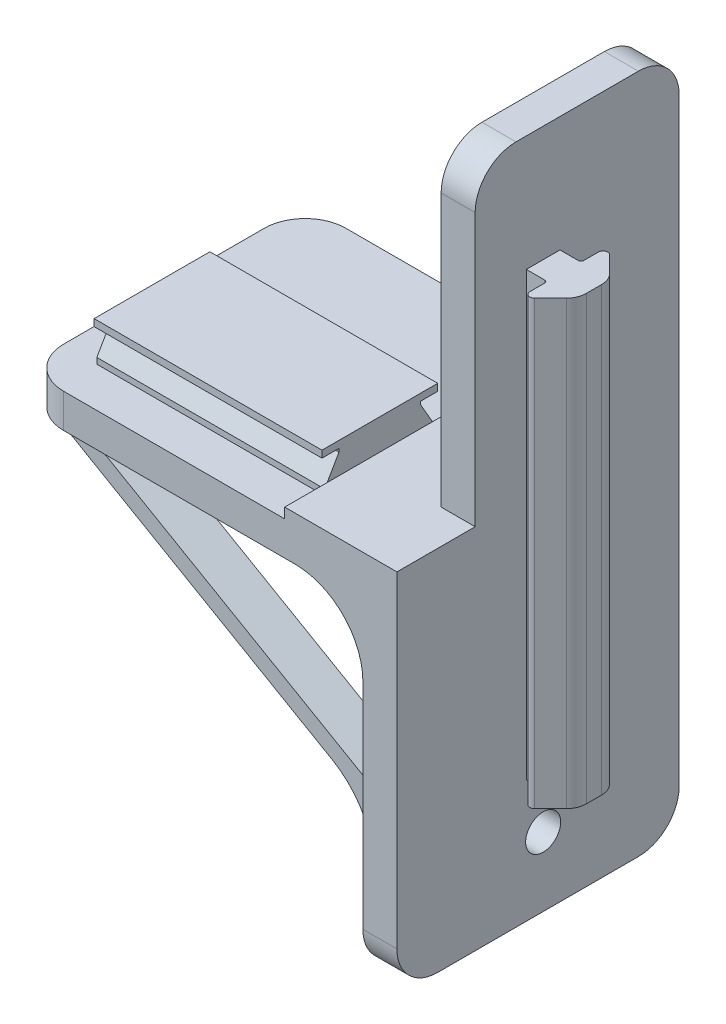
from build123d import *

# Parameters (mm, degrees)
BOSS_EXTRUDE5_DEPTH  = 50
SKETCH11_W           = 41.5
SKETCH11_H           = 100
BOSS_EXTRUDE6_DEPTH  = 5
SKETCH12_W           = 41.5
SKETCH12_H           = 5
BOSS_EXTRUDE8_DEPTH  = 55
SKETCH13_W           = 11.5
SKETCH13_H           = 47.5
CUT_EXTRUDE1_DEPTH   = 55
BOSS_EXTRUDE9_DEPTH  = 6
FILLET7_R            = 12
FILLET7_OF_MIRROR1_R = 12
FILLET8_R            = 6
BOSS_EXTRUDE10_START = 8
BOSS_EXTRUDE10_DEPTH = 8
FILLET12_R           = 10
BOSS_EXTRUDE11_DEPTH = 57
SKETCH16_R           = 2.575
CUT_EXTRUDE2_DEPTH   = 10
SKETCH17_W           = 27.480150942
SKETCH17_H           = 1.5
BOSS_EXTRUDE12_DEPTH = 11.5
SKETCH18_W           = 11.5
SKETCH18_H           = 1.5
BOSS_EXTRUDE13_DEPTH = 5
BOSS_EXTRUDE14_START = -5
BOSS_EXTRUDE14_DEPTH = 33.5


with BuildPart() as part:
    # Sketch9 → Boss-Extrude5 (new body)
    with BuildSketch(Plane(origin=(0, 245, 0), x_dir=(1, 0, 0), z_dir=(0, 1, 0))):
        with BuildLine():
            Line((389.629800237, -111.599739584), (387.629800237, -111.599739584))
            Line((387.629800237, -111.599739584), (387.629800237, -106.649739584))
            Line((387.629800237, -106.649739584), (389.629800237, -106.649739584))
            Line((389.629800237, -106.649739584), (390.329799474, -106.649739584))
            ThreePointArc((390.329799474, -106.649739584), (390.605571069, -106.535511279), (390.719799474, -106.259739725))
            Line((390.719799474, -106.259739725), (390.719800256, -104.090618139))
            ThreePointArc((390.719800256, -104.090618139), (391.145748802, -103.453141463), (391.897703935, -103.602714709))
            Line((391.897703935, -103.602714709), (394.237480965, -105.942491739))
            ThreePointArc((394.237480965, -105.942491739), (394.868289671, -106.886563682), (395.089800232, -108.000172467))
            Line((395.089800232, -108.000172467), (395.089800237, -110.249306685))
            ThreePointArc((395.089800237, -110.249306685), (394.868289678, -111.362915477), (394.23748097, -112.306987424))
            Line((394.23748097, -112.306987424), (391.897703941, -114.646764454))
            ThreePointArc((391.897703941, -114.646764454), (391.145748809, -114.7963377), (390.719800262, -114.158861025))
            Line((390.719800262, -114.158861025), (390.719799474, -111.989739443))
            ThreePointArc((390.719799474, -111.989739443), (390.605571069, -111.71396789), (390.329799474, -111.599739584))
            Line((390.329799474, -111.599739584), (389.629800237, -111.599739584))
        make_face()
    extrude(amount=-BOSS_EXTRUDE5_DEPTH)

    # Sketch11 → Boss-Extrude6 (add)
    with BuildSketch(Plane.ZY.offset(-387.629800242)):
        with Locations((109.874739584, 220)):
            Rectangle(SKETCH11_W, SKETCH11_H)
    extrude(amount=BOSS_EXTRUDE6_DEPTH)

    # Sketch12 → Boss-Extrude8 (add)
    with BuildSketch(Plane.ZY.offset(-387.629800242)):
        with Locations((109.874739584, 220)):
            Rectangle(SKETCH12_W, SKETCH12_H)
    extrude(amount=BOSS_EXTRUDE8_DEPTH)

    # Sketch13 → Cut-Extrude1 (cut)
    with BuildSketch(Plane.ZY.offset(-387.629800242)):
        with Locations((124.874739584, 246.25)):
            Rectangle(SKETCH13_W, SKETCH13_H)
    extrude(amount=CUT_EXTRUDE1_DEPTH, mode=Mode.SUBTRACT)

    # Sketch15 → Boss-Extrude9 (add)
    with BuildSketch(Plane.XY.offset(129.124739584)):
        Polygon((335.629800242, 217.5), (382.629800242, 190.364537348), (382.629800242, 193.251288694), (340.629800242, 217.5), align=None)
    boss_extrude9 = extrude(amount=-BOSS_EXTRUDE9_DEPTH)

    # Fillet7
    # the kernel refuses this fillet: 12 mm, written as the material it adds along each edge
    with BuildSketch(Plane(origin=(335.629800242, 217.5, 129.124739584), x_dir=(-1, 0, 0), z_dir=(0, 0, -1))) as fillet7_piece_1:
        with BuildLine():
            CenterArc((3.218847051, -11.998004249), FILLET7_R, 91.044975628, 28.955024372)
            Line((-2.781152949, -1.605699404), (-2.901152949, -1.397853307))
            Line((-2.901152949, -1.397853307), (-0.12, 0.207846097))
            Line((-0.12, 0.207846097), (0, 0.24))
            ThreePointArc((0, 0.24), (1.5, 0.24), (2.995623059, 0.239960085))
            Line((2.995623059, 0.239960085), (3, 0))
        make_face()
    extrude(amount=6)
    with BuildSketch(Plane(origin=(382.629800242, 190.364537348, 129.124739584), x_dir=(0, -1, 0), z_dir=(0, 0, -1))) as fillet7_piece_2:
        with BuildLine():
            CenterArc((FILLET7_R * 0.57735026919, FILLET7_R), FILLET7_R, 210, 60)
            Line((-FILLET7_R * 0.288675134595, FILLET7_R * 0.5), (-FILLET7_R * 0.305995642671, FILLET7_R * 0.49))
            Line((-FILLET7_R * 0.305995642671, FILLET7_R * 0.49), (-FILLET7_R * 0.0115470053838, -FILLET7_R * 0.02))
            Line((-FILLET7_R * 0.0115470053838, -FILLET7_R * 0.02), (FILLET7_R * 0.57735026919, -FILLET7_R * 0.02))
            Line((FILLET7_R * 0.57735026919, -FILLET7_R * 0.02), (FILLET7_R * 0.57735026919, 0))
        make_face()
    extrude(amount=6)

    # Mirror1: Boss-Extrude9 across plane
    add(boss_extrude9.mirror(Plane.XY.offset(110.624739584)))

    # Fillet7 of Mirror1
    # the kernel refuses this fillet: 12 mm, written as the material it adds along each edge
    with BuildSketch(Plane(origin=(335.629800242, 217.5, 92.124739584), x_dir=(-1, 0, 0), z_dir=(0, 0, 1))) as fillet7_of_mirror1_piece_1:
        with BuildLine():
            CenterArc((3.218847051, 11.998004249), FILLET7_OF_MIRROR1_R, 240, 28.955024372)
            Line((-2.781152949, 1.605699404), (-2.901152949, 1.397853307))
            Line((-2.901152949, 1.397853307), (-0.12, -0.207846097))
            Line((-0.12, -0.207846097), (0, -0.24))
            ThreePointArc((0, -0.24), (1.5, -0.24), (2.995623059, -0.239960085))
            Line((2.995623059, -0.239960085), (3, 0))
        make_face()
    extrude(amount=6)
    with BuildSketch(Plane(origin=(382.629800242, 190.364537348, 92.124739584), x_dir=(0, -1, 0), z_dir=(0, 0, 1))) as fillet7_of_mirror1_piece_2:
        with BuildLine():
            CenterArc((FILLET7_OF_MIRROR1_R * 0.57735026919, -FILLET7_OF_MIRROR1_R), FILLET7_OF_MIRROR1_R, 90, 60)
            Line((-FILLET7_OF_MIRROR1_R * 0.288675134595, -FILLET7_OF_MIRROR1_R * 0.5), (-FILLET7_OF_MIRROR1_R * 0.305995642671, -FILLET7_OF_MIRROR1_R * 0.49))
            Line((-FILLET7_OF_MIRROR1_R * 0.305995642671, -FILLET7_OF_MIRROR1_R * 0.49), (-FILLET7_OF_MIRROR1_R * 0.0115470053838, FILLET7_OF_MIRROR1_R * 0.02))
            Line((-FILLET7_OF_MIRROR1_R * 0.0115470053838, FILLET7_OF_MIRROR1_R * 0.02), (FILLET7_OF_MIRROR1_R * 0.57735026919, FILLET7_OF_MIRROR1_R * 0.02))
            Line((FILLET7_OF_MIRROR1_R * 0.57735026919, FILLET7_OF_MIRROR1_R * 0.02), (FILLET7_OF_MIRROR1_R * 0.57735026919, 0))
        make_face()
    extrude(amount=6)

    # Fillet8
    # the kernel refuses this fillet: 6 mm, written as the material it takes off along each edge
    with BuildSketch(Plane(origin=(402.629800242, 270, 89.124739584), x_dir=(0, 0, 1), z_dir=(-1, 0, 0)), Plane(origin=(332.629800242, 237.5, 89.124739584), x_dir=(0, 0, 1), z_dir=(0, -1, 0)), Plane(origin=(402.629800242, 270, 119.124739584), x_dir=(0, -1, 0), z_dir=(-1, 0, 0))) as fillet8_piece_1:
        with BuildLine():
            CenterArc((FILLET8_R, -FILLET8_R), FILLET8_R, 90, 90)
            Line((0, -FILLET8_R), (0, 0))
            Line((0, 0), (FILLET8_R, 0))
        make_face()
    extrude(amount=35, mode=Mode.SUBTRACT)
    with BuildSketch(Plane(origin=(402.629800242, 170, 89.124739584), x_dir=(0, 0, 1), z_dir=(-1, 0, 0)), Plane(origin=(402.629800242, 170, 130.624739584), x_dir=(0, 1, 0), z_dir=(-1, 0, 0)), Plane(origin=(332.629800242, 202.5, 130.624739584), x_dir=(1, 0, 0), z_dir=(0, 1, 0))) as fillet8_piece_2:
        with BuildLine():
            CenterArc((FILLET8_R, FILLET8_R), FILLET8_R, 180, 90)
            Line((0, FILLET8_R), (0, 0))
            Line((0, 0), (FILLET8_R, 0))
        make_face()
    extrude(amount=35, mode=Mode.SUBTRACT)

    # Sketch9<2> → Boss-Extrude10 (add)
    with BuildSketch(Plane(origin=(0, 245, 0), x_dir=(1, 0, 0), z_dir=(0, 1, 0)).offset(BOSS_EXTRUDE10_START)):
        with BuildLine():
            Line((389.629800237, -111.599739584), (387.629800237, -111.599739584))
            Line((387.629800237, -111.599739584), (387.629800237, -106.649739584))
            Line((387.629800237, -106.649739584), (389.629800237, -106.649739584))
            Line((389.629800237, -106.649739584), (390.329799474, -106.649739584))
            ThreePointArc((390.329799474, -106.649739584), (390.605571069, -106.535511279), (390.719799474, -106.259739725))
            Line((390.719799474, -106.259739725), (390.719800256, -104.090618139))
            ThreePointArc((390.719800256, -104.090618139), (391.145748802, -103.453141463), (391.897703935, -103.602714709))
            Line((391.897703935, -103.602714709), (394.237480965, -105.942491739))
            ThreePointArc((394.237480965, -105.942491739), (394.868289671, -106.886563682), (395.089800232, -108.000172467))
            Line((395.089800232, -108.000172467), (395.089800237, -110.249306685))
            ThreePointArc((395.089800237, -110.249306685), (394.868289678, -111.362915477), (394.23748097, -112.306987424))
            Line((394.23748097, -112.306987424), (391.897703941, -114.646764454))
            ThreePointArc((391.897703941, -114.646764454), (391.145748809, -114.7963377), (390.719800262, -114.158861025))
            Line((390.719800262, -114.158861025), (390.719799474, -111.989739443))
            ThreePointArc((390.719799474, -111.989739443), (390.605571069, -111.71396789), (390.329799474, -111.599739584))
            Line((390.329799474, -111.599739584), (389.629800237, -111.599739584))
        make_face()
    extrude(amount=-BOSS_EXTRUDE10_DEPTH)

    # Fillet12
    fillet12_edges = [part.edges().sort_by_distance(p)[0] for p in [
        (382.629800242, 217.5, 109.874739584),
    ]]
    fillet(fillet12_edges, radius=FILLET12_R)

    # Sketch9<3> → Boss-Extrude11 (add)
    with BuildSketch(Plane(origin=(0, 245, 0), x_dir=(1, 0, 0), z_dir=(0, 1, 0))):
        with BuildLine():
            Line((389.629800237, -111.599739584), (387.629800237, -111.599739584))
            Line((387.629800237, -111.599739584), (387.629800237, -106.649739584))
            Line((387.629800237, -106.649739584), (389.629800237, -106.649739584))
            Line((389.629800237, -106.649739584), (390.329799474, -106.649739584))
            ThreePointArc((390.329799474, -106.649739584), (390.605571069, -106.535511279), (390.719799474, -106.259739725))
            Line((390.719799474, -106.259739725), (390.719800256, -104.090618139))
            ThreePointArc((390.719800256, -104.090618139), (391.145748802, -103.453141463), (391.897703935, -103.602714709))
            Line((391.897703935, -103.602714709), (394.237480965, -105.942491739))
            ThreePointArc((394.237480965, -105.942491739), (394.868289671, -106.886563682), (395.089800232, -108.000172467))
            Line((395.089800232, -108.000172467), (395.089800237, -110.249306685))
            ThreePointArc((395.089800237, -110.249306685), (394.868289678, -111.362915477), (394.23748097, -112.306987424))
            Line((394.23748097, -112.306987424), (391.897703941, -114.646764454))
            ThreePointArc((391.897703941, -114.646764454), (391.145748809, -114.7963377), (390.719800262, -114.158861025))
            Line((390.719800262, -114.158861025), (390.719799474, -111.989739443))
            ThreePointArc((390.719799474, -111.989739443), (390.605571069, -111.71396789), (390.329799474, -111.599739584))
            Line((390.329799474, -111.599739584), (389.629800237, -111.599739584))
        make_face()
    extrude(amount=-BOSS_EXTRUDE11_DEPTH)

    # Sketch16 → Cut-Extrude2 (cut)
    with BuildSketch(Plane.ZY.offset(-382.629800242)):
        with Locations((109.124739584, 180.133064736)):
            Circle(SKETCH16_R)
    extrude(amount=-CUT_EXTRUDE2_DEPTH, mode=Mode.SUBTRACT)

    # Sketch17 → Boss-Extrude12 (add)
    with BuildSketch(Plane(origin=(371.129800242, 0, 0), x_dir=(0, 0, -1), z_dir=(1, 0, 0))):
        with Locations((-116.884664113, 223.25)):
            Rectangle(SKETCH17_W, SKETCH17_H)
    extrude(amount=BOSS_EXTRUDE12_DEPTH)

    # Sketch18 → Boss-Extrude13 (add)
    with BuildSketch(Plane(origin=(382.629800242, 0, 0), x_dir=(0, 0, -1), z_dir=(1, 0, 0))):
        with Locations((-124.874739584, 223.25)):
            Rectangle(SKETCH18_W, SKETCH18_H)
    extrude(amount=BOSS_EXTRUDE13_DEPTH)

    # Sketch19 → Boss-Extrude14 (add)
    with BuildSketch(Plane.ZY.offset(-332.629800242).offset(BOSS_EXTRUDE14_START)):
        Polygon((125.144664113, 227.49), (125.144664113, 228.51), (108.124664113, 228.51), (108.124664113, 227.49), (110.624664113, 227.49), (110.624664113, 227.002681543), (108.524291386, 223.367942117), (108.524291386, 222.5), (124.745036841, 222.5), (124.745036841, 223.367942117), (122.644664113, 227.002681543), (122.644664113, 227.49), align=None)
    extrude(amount=-BOSS_EXTRUDE14_DEPTH)


solid = part.part
